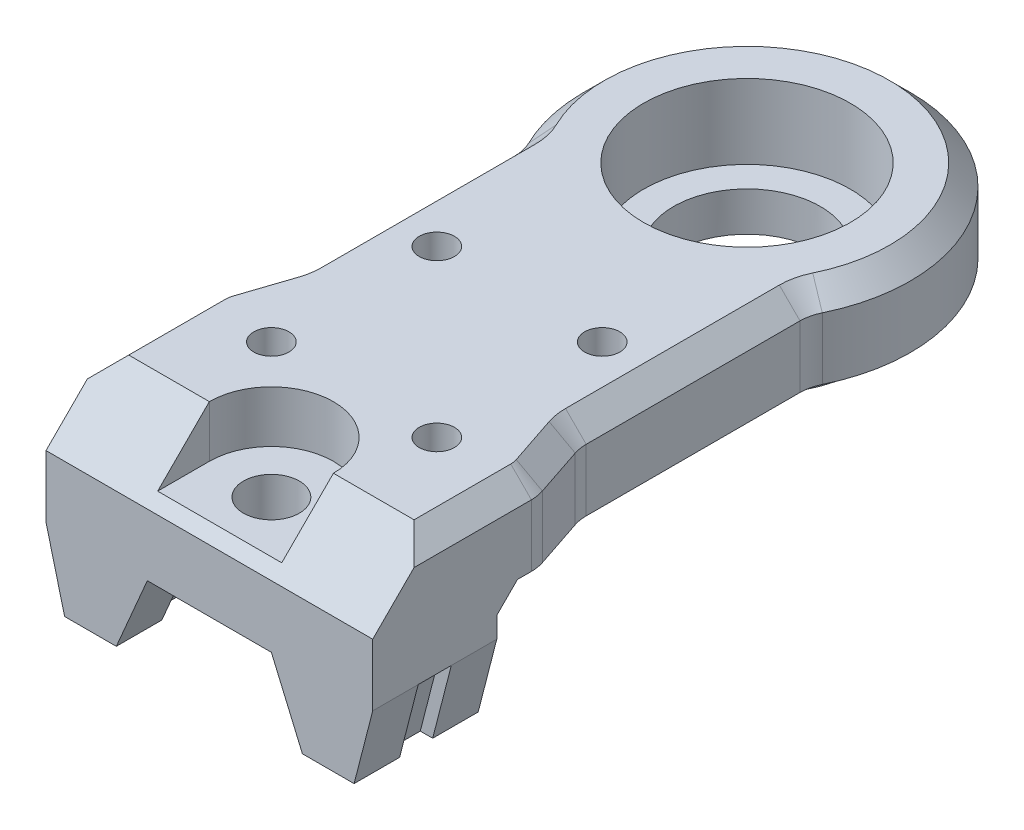
from build123d import *
from build123d.topology import SkipClean

# Parameters (mm, degrees)
EXTRUDE_1_DEPTH        = 4
EXTRUDE_3_DEPTH        = 6
CHAMFER_1_SIZE         = 3
SKETCH_5_R             = 0.85
CUT_EXTRUDE_1_DEPTH    = 4
PATTERN_LINEAR_1_COUNT = 2
PATTERN_LINEAR_1_PITCH = 8
CUT_EXTRUDE_2_DEPTH    = 2.5
CUT_EXTRUDE_3_REACH    = 30.061
SKETCH_7_R             = 1.35
SKETCH_8_R             = 6
EXTRUDE_4_DEPTH        = 1.5
FILLET_1_R             = 0.5
SKETCH_9_R             = 5
CUT_EXTRUDE_4_DEPTH    = 3.6
SKETCH_10_R            = 3.55
CUT_EXTRUDE_5_DEPTH    = 3.6
CUT_EXTRUDE_6_DEPTH    = 0.8
CUT_EXTRUDE_7_DEPTH    = 29.786455148
FILLET_2_R             = 2
CHAMFER_2_SIZE         = 1


with BuildPart() as part:
    # ｽｹｯﾁ1 → ﾎﾞｽ - 押し出し1 (new body)
    with BuildSketch(Plane(origin=(0, 0, 0), x_dir=(1, 0, 0), z_dir=(0, 1, 0))):
        with BuildLine():
            Line((-7.9, 0), (-7.9, -26))
            Line((-7.9, -26), (7.9, -26))
            Line((7.9, -26), (7.9, 0))
            ThreePointArc((7.9, 0), (0, 7.9), (-7.9, 0))
        make_face()
    extrude(amount=EXTRUDE_1_DEPTH)

    # ｽｹｯﾁ4 → ﾎﾞｽ - 押し出し3 (add)
    with BuildSketch(Plane.XY.offset(26)):
        Polygon((-7, -5.5), (-4.5, -5.5), (-3, -2), (3, -2), (4.5, -5.5), (7, -5.5), (7.9, -2), (7.9, 0), (-7.9, 0), (-7.9, -2), align=None)
    extrude(amount=-EXTRUDE_3_DEPTH)

    # 面取り1
    chamfer_1_edges = [part.edges().sort_by_distance(p)[0] for p in [
        (0, 4, 26),
    ]]
    chamfer(chamfer_1_edges, length=CHAMFER_1_SIZE)

    # ｽｹｯﾁ5 → ｶｯﾄ - 押し出し1 (cut)
    with BuildSketch(Plane(origin=(0, 4, 0), x_dir=(1, 0, 0), z_dir=(0, 1, 0))):
        with Locations(Location((-4, -19, 0), (0, 0, 270))):
            Circle(SKETCH_5_R)
        with Locations(Location((4, -19, 0), (0, 0, 270))):
            Circle(SKETCH_5_R)
    cut_extrude_1 = extrude(amount=-CUT_EXTRUDE_1_DEPTH, mode=Mode.SUBTRACT)

    # 直線ﾊﾟﾀｰﾝ1: ｶｯﾄ - 押し出し1 ×2
    with Locations(*[(0, 0, -i * PATTERN_LINEAR_1_PITCH) for i in range(1, PATTERN_LINEAR_1_COUNT)]):
        add(cut_extrude_1, mode=Mode.SUBTRACT)

    # ｽｹｯﾁ6 → ｶｯﾄ - 押し出し2 (cut)
    with BuildSketch(Plane(origin=(0, 4, 0), x_dir=(1, 0, 0), z_dir=(0, 1, 0))):
        with BuildLine():
            Line((-3, -23), (-3, -27))
            Line((-3, -27), (3, -27))
            Line((3, -27), (3, -23))
            ThreePointArc((3, -23), (0, -20), (-3, -23))
        make_face()
    extrude(amount=-CUT_EXTRUDE_2_DEPTH, mode=Mode.SUBTRACT)

    # ｽｹｯﾁ7 → ｶｯﾄ - 押し出し3 (cut, up to next)
    with BuildSketch(Plane(origin=(0, 1.5, 0), x_dir=(1, 0, 0), z_dir=(0, 1, 0)), mode=Mode.PRIVATE) as cut_extrude_3_sk1:
        with Locations(Location((0, -23, 0), (0, 0, 270))):
            Circle(SKETCH_7_R)
    cut_extrude_3_tool1 = extrude(cut_extrude_3_sk1.sketch, amount=-CUT_EXTRUDE_3_REACH, mode=Mode.PRIVATE) & part.part
    add(cut_extrude_3_tool1.solids().sort_by_distance((0, 1.5, 23))[0], mode=Mode.SUBTRACT)

    # ｽｹｯﾁ8 → ﾎﾞｽ - 押し出し4 (add)
    with BuildSketch(Plane.XZ):
        with Locations(Location((0, 0, 0), (0, 0, 90))):
            Circle(SKETCH_8_R)
    extrude(amount=EXTRUDE_4_DEPTH)

    # ﾌｨﾚｯﾄ1
    fillet_1_edges = [part.edges().sort_by_distance(p)[0] for p in [
        (0, 0, -6),
    ]]
    fillet(fillet_1_edges, radius=FILLET_1_R)

    # ｽｹｯﾁ9 → ｶｯﾄ - 押し出し4 (cut)
    with BuildSketch(Plane(origin=(0, 4, 0), x_dir=(1, 0, 0), z_dir=(0, 1, 0))):
        with Locations(Location((0, 0, 0), (0, 0, 270))):
            Circle(SKETCH_9_R)
    extrude(amount=-CUT_EXTRUDE_4_DEPTH, mode=Mode.SUBTRACT)

    # ｽｹｯﾁ10 → ｶｯﾄ - 押し出し5 (cut)
    with BuildSketch(Plane(origin=(0, 0.4, 0), x_dir=(1, 0, 0), z_dir=(0, 1, 0))):
        with Locations(Location((0, 0, 0), (0, 0, 270))):
            Circle(SKETCH_10_R)
    extrude(amount=-CUT_EXTRUDE_5_DEPTH, mode=Mode.SUBTRACT)

    # ｽｹｯﾁ11 → ｶｯﾄ - 押し出し6 (cut, symmetric)
    with BuildSketch(Plane.XY.offset(23)):
        Polygon((3, -2), (4.5, -5.5), (5.1, -5.5), (3.6, -2), align=None)
        Polygon((7.9, -2), (7, -5.5), (6.4, -5.5), (7.3, -2), align=None)
    cut_extrude_6 = extrude(amount=CUT_EXTRUDE_6_DEPTH, both=True, mode=Mode.SUBTRACT)

    # ﾐﾗｰ1: ｶｯﾄ - 押し出し6 across plane
    add(cut_extrude_6.mirror(Plane(origin=(0, 0, 0), x_dir=(0, 0, 1), z_dir=(1, 0, 0))), mode=Mode.SUBTRACT)

    # ｽｹｯﾁ12 → ｶｯﾄ - 押し出し7 (cut, through all)
    with SkipClean():  # the faces are left unmerged after this step: merging them gives an invalid solid
        with BuildSketch(Plane(origin=(0, 4, 0), x_dir=(1, 0, 0), z_dir=(0, 1, 0))):
            with BuildLine():
                Line((-7.9, -18), (-6.9, -15))
                Line((-6.9, -15), (-6.9, -3.847076812))
                ThreePointArc((-6.9, -3.847076812), (-7.645913941, -1.987460691), (-7.9, 0))
                Line((-7.9, 0), (-7.9, -18))
            make_face()
        cut_extrude_7 = extrude(amount=-CUT_EXTRUDE_7_DEPTH, mode=Mode.SUBTRACT)

    # ﾐﾗｰ2: ｶｯﾄ - 押し出し7 across plane
    with SkipClean():  # the faces are left unmerged after this step: merging them gives an invalid solid
        add(cut_extrude_7.mirror(Plane(origin=(0, 0, 0), x_dir=(0, 0, 1), z_dir=(1, 0, 0))), mode=Mode.SUBTRACT)

    # ﾌｨﾚｯﾄ2
    fillet_2_edges = [part.edges().sort_by_distance(p)[0] for p in [
        (-7.9, 2, 18),
        (-6.9, 2, 3.847076812),
        (-6.9, 2, 15),
        (7.9, 2, 18),
        (6.9, 2, 15),
        (6.9, 2, 3.847076812),
    ]]
    fillet(fillet_2_edges, radius=FILLET_2_R)

    # 面取り2
    # the kernel refuses this chamfer: 1 mm, written as the material it adds along each edge
    with BuildSketch(Plane(origin=(7.9, 0, 20), x_dir=(0, 0.02749587661058639, -0.9996219169112968), z_dir=(-1, 0, 0))) as chamfer_2_piece_1_section:
        Polygon((CHAMFER_2_SIZE * 0.999621916911, CHAMFER_2_SIZE * 0.0274958766106), (-CHAMFER_2_SIZE * 0.0274958766106, CHAMFER_2_SIZE * 0.999621916911), (0, 0), align=None)
    chamfer_2_piece_1 = extrude(amount=15.8, mode=Mode.PRIVATE)
    chamfer_2_piece_1 = chamfer_2_piece_1 - Plane(origin=(-4, -0.34097177, 19), x_dir=(0, 0, 1), z_dir=(0, 1, 0)) * Cylinder(0.85, 36, mode=Mode.PRIVATE)
    chamfer_2_piece_1 = chamfer_2_piece_1 - Plane(origin=(4, -0.34097177, 19), x_dir=(0, 0, 1), z_dir=(0, 1, 0)) * Cylinder(0.85, 36, mode=Mode.PRIVATE)
    add(chamfer_2_piece_1)
    # the kernel refuses this chamfer: 1 mm, written as the material it takes off along each edge
    with BuildSketch(Plane(origin=(-7.9, 4, 18.32455532), x_dir=(-0.027495876610586487, -0.9996219169112968, 0), z_dir=(0, 0, 1)), Plane(origin=(7.9, 4, 25.571682988), x_dir=(0.027495876610586487, -0.9996219169112968, 0), z_dir=(0, 0, -1))) as chamfer_2_2_piece_1:
        Polygon((CHAMFER_2_SIZE * 0.999621916911, CHAMFER_2_SIZE * 0.0274958766106), (-CHAMFER_2_SIZE * 0.0274958766106, CHAMFER_2_SIZE * 0.999621916911), (0, 0), align=None)
    extrude(amount=7.247127668, mode=Mode.SUBTRACT)
    with BuildSketch(Plane(origin=(0, 4, 0), x_dir=(1, 0, 0), z_dir=(0, 0, 1))) as chamfer_2_2_piece_2:
        Polygon((7.9, -CHAMFER_2_SIZE), (7.9 - CHAMFER_2_SIZE, 0), (7.9, 0), align=None)
    revolve(axis=Axis((0, 4, 0), (0, 1, 0)), revolution_arc=180, mode=Mode.SUBTRACT)
    with BuildSketch(Plane(origin=(-5.9, 4, 18.32455532), x_dir=(-1, 0, 0), z_dir=(0, 0, 1))) as chamfer_2_2_piece_3:
        Polygon((2, CHAMFER_2_SIZE), (2 - CHAMFER_2_SIZE, 0), (2, 0), align=None)
    revolve(axis=Axis((-5.9, 4, 18.32455532), (0, -1, 0)), revolution_arc=18.434948823, mode=Mode.SUBTRACT)
    with BuildSketch(Plane(origin=(-7.797366596, 4, 17.692099788), x_dir=(-0.026084878905720917, -0.9996219169112968, -0.008694959635240323), z_dir=(0.31622776601683844, 0, -0.9486832980505137))) as chamfer_2_2_piece_4:
        Polygon((CHAMFER_2_SIZE * 0.999621916911, -CHAMFER_2_SIZE * 0.0274958766106), (-CHAMFER_2_SIZE * 0.0274958766106, -CHAMFER_2_SIZE * 0.999621916911), (0, 0), align=None)
    extrude(amount=2.513167019, mode=Mode.SUBTRACT)
    with BuildSketch(Plane(origin=(-8.9, 4, 14.67544468), x_dir=(0.9486832980505138, 0, 0.31622776601683794), z_dir=(-0.31622776601683794, 0, 0.9486832980505138))) as chamfer_2_2_piece_5:
        Polygon((2, -CHAMFER_2_SIZE), (2 + CHAMFER_2_SIZE, 0), (2, 0), align=None)
    revolve(axis=Axis((-8.9, 4, 14.67544468), (0, 1, 0)), revolution_arc=18.434948823, mode=Mode.SUBTRACT)
    with BuildSketch(Plane(origin=(-6.9, 4, 14.67544468), x_dir=(-0.027495876610586487, -0.9996219169112968, 0), z_dir=(0, 0, -1))) as chamfer_2_2_piece_6:
        Polygon((CHAMFER_2_SIZE * 0.999621916911, -CHAMFER_2_SIZE * 0.0274958766106), (-CHAMFER_2_SIZE * 0.0274958766106, -CHAMFER_2_SIZE * 0.999621916911), (0, 0), align=None)
    extrude(amount=10.339548002, mode=Mode.SUBTRACT)
    with BuildSketch(Plane(origin=(-8.9, 4, 4.335896678), x_dir=(1, 0, 0), z_dir=(0, 0, 1))) as chamfer_2_2_piece_7:
        Polygon((2, -CHAMFER_2_SIZE), (2 + CHAMFER_2_SIZE, 0), (2, 0), align=None)
    revolve(axis=Axis((-8.9, 4, 4.335896678), (0, 1, 0)), revolution_arc=25.974390018, mode=Mode.SUBTRACT)
    with BuildSketch(Plane(origin=(8.9, 4, 4.335896678), x_dir=(-0.8989898989898989, 0, -0.43796936138745074), z_dir=(0.43796936138745074, 0, -0.8989898989898989))) as chamfer_2_2_piece_8:
        Polygon((2, -CHAMFER_2_SIZE), (2 + CHAMFER_2_SIZE, 0), (2, 0), align=None)
    revolve(axis=Axis((8.9, 4, 4.335896678), (0, 1, 0)), revolution_arc=25.974390018, mode=Mode.SUBTRACT)
    with BuildSketch(Plane(origin=(6.9, 4, 14.67544468), x_dir=(0.027495876610586487, -0.9996219169112968, 0), z_dir=(0, 0, -1))) as chamfer_2_2_piece_9:
        Polygon((CHAMFER_2_SIZE * 0.999621916911, CHAMFER_2_SIZE * 0.0274958766106), (-CHAMFER_2_SIZE * 0.0274958766106, CHAMFER_2_SIZE * 0.999621916911), (0, 0), align=None)
    extrude(amount=10.339548002, mode=Mode.SUBTRACT)
    with BuildSketch(Plane(origin=(8.9, 4, 14.67544468), x_dir=(-1, 0, 0), z_dir=(0, 0, -1))) as chamfer_2_2_piece_10:
        Polygon((2, -CHAMFER_2_SIZE), (2 + CHAMFER_2_SIZE, 0), (2, 0), align=None)
    revolve(axis=Axis((8.9, 4, 14.67544468), (0, 1, 0)), revolution_arc=18.434948823, mode=Mode.SUBTRACT)
    with BuildSketch(Plane(origin=(7.797366596, 4, 17.692099788), x_dir=(0.026084878905720917, -0.9996219169112968, -0.008694959635240323), z_dir=(-0.31622776601683844, 0, -0.9486832980505137))) as chamfer_2_2_piece_11:
        Polygon((CHAMFER_2_SIZE * 0.999621916911, CHAMFER_2_SIZE * 0.0274958766106), (-CHAMFER_2_SIZE * 0.0274958766106, CHAMFER_2_SIZE * 0.999621916911), (0, 0), align=None)
    extrude(amount=2.513167019, mode=Mode.SUBTRACT)
    with BuildSketch(Plane(origin=(5.9, 4, 18.32455532), x_dir=(0.9486832980505135, 0, -0.3162277660168389), z_dir=(-0.3162277660168389, 0, -0.9486832980505135))) as chamfer_2_2_piece_12:
        Polygon((2, CHAMFER_2_SIZE), (2 - CHAMFER_2_SIZE, 0), (2, 0), align=None)
    revolve(axis=Axis((5.9, 4, 18.32455532), (0, -1, 0)), revolution_arc=18.434948823, mode=Mode.SUBTRACT)
    with BuildSketch(Plane(origin=(0, 4, 0), x_dir=(0.898989898989899, 0, 0.4379693613874505), z_dir=(-0.4379693613874505, 0, 0.898989898989899))) as chamfer_2_2_piece_13:
        Polygon((7.9, -CHAMFER_2_SIZE), (7.9 - CHAMFER_2_SIZE, 0), (7.9, 0), align=None)
    revolve(axis=Axis((0, 4, 0), (0, 1, 0)), revolution_arc=25.974390018, mode=Mode.SUBTRACT)
    with BuildSketch(Plane(origin=(0, 4, 0), x_dir=(-0.898989898989899, 0, 0.4379693613874506), z_dir=(0.4379693613874506, 0, 0.898989898989899))) as chamfer_2_2_piece_14:
        Polygon((7.9, CHAMFER_2_SIZE), (7.9 - CHAMFER_2_SIZE, 0), (7.9, 0), align=None)
    revolve(axis=Axis((0, 4, 0), (0, -1, 0)), revolution_arc=25.974390018, mode=Mode.SUBTRACT)


solid = part.part
